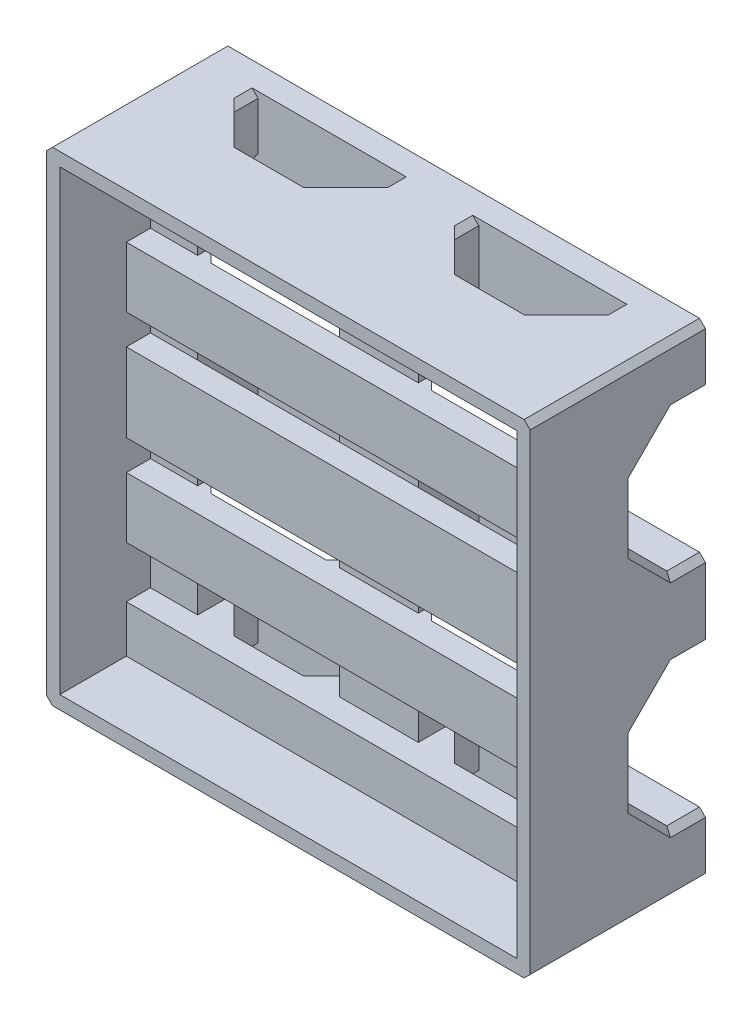
from build123d import *

# Parameters (mm, degrees)
CROQUIS1_W                = 13
CROQUIS1_H                = 80
SALIENTE_EXTRUIR1_DEPTH   = 4
CROQUIS1_W_2              = 10
SALIENTE_EXTRUIR1_2_DEPTH = 4
SALIENTE_EXTRUIR1_3_DEPTH = 4
CROQUIS2_W                = 13
CROQUIS2_H                = 13
CROQUIS2_W_2              = 10
CROQUIS2_H_2              = 10
SALIENTE_EXTRUIR2_DEPTH   = 10
CROQUIS3_W                = 13
CROQUIS3_H                = 80
CROQUIS3_W_2              = 10
SALIENTE_EXTRUIR3_DEPTH   = 2.2
CROQUIS4_W                = 80
CROQUIS4_H                = 10
CROQUIS4_H_2              = 13
SALIENTE_EXTRUIR4_DEPTH   = 4
CROQUIS5_W                = 80
CROQUIS5_H                = 80
CROQUIS5_W_2              = 75.6
CROQUIS5_H_2              = 75.6
SALIENTE_EXTRUIR5_DEPTH   = 15
CHAFL_N2_SIZE             = 6.4
CHAFL_N3_SIZE             = 6
CHAFL_N4_SIZE             = 2.2
CROQUIS6_W                = 10
CROQUIS6_H                = 10
CORTAR_EXTRUIR1_DEPTH     = 0.4
REDONDEO1_R               = 1
CHAFL_N1_SIZE             = 1


with BuildPart() as part:
    # Croquis1 → Saliente-Extruir1 (new body)
    with BuildSketch(Plane(origin=(0, 0, 0), x_dir=(0, 1, 0), z_dir=(0, 0, 1))):
        Rectangle(CROQUIS1_W, CROQUIS1_H)
    extrude(amount=SALIENTE_EXTRUIR1_DEPTH)



with BuildPart() as body_2:
    # Croquis1 → Saliente-Extruir1 2 (new body)
    with BuildSketch(Plane(origin=(0, 0, 0), x_dir=(0, 1, 0), z_dir=(0, 0, 1))):
        with Locations((35, 0)):
            Rectangle(CROQUIS1_W_2, CROQUIS1_H)
    extrude(amount=SALIENTE_EXTRUIR1_2_DEPTH)


with BuildPart() as body_3:
    # Croquis1 → Saliente-Extruir1 3 (new body)
    with BuildSketch(Plane(origin=(0, 0, 0), x_dir=(0, 1, 0), z_dir=(0, 0, 1))):
        with Locations((-35, 0)):
            Rectangle(CROQUIS1_W_2, CROQUIS1_H)
    extrude(amount=SALIENTE_EXTRUIR1_3_DEPTH)


with BuildPart() as part_1:
    add(part.part)

    add(body_2.part)  # Saliente-Extruir2 merges body 2

    add(body_3.part)  # Saliente-Extruir2 merges body 3
    # Croquis2 → Saliente-Extruir2 (add)
    with BuildSketch(Plane.XY.offset(4)):
        Rectangle(CROQUIS2_W, CROQUIS2_H)
        with Locations((-35, 0)):
            Rectangle(CROQUIS2_W_2, CROQUIS2_H)
        with Locations((35, 0)):
            Rectangle(CROQUIS2_W_2, CROQUIS2_H)
        with Locations((0, 35)):
            Rectangle(CROQUIS2_W, CROQUIS2_H_2)
        with Locations((-35, 35)):
            Rectangle(CROQUIS2_W_2, CROQUIS2_H_2)
        with Locations((35, 35)):
            Rectangle(CROQUIS2_W_2, CROQUIS2_H_2)
        with Locations((35, -35)):
            Rectangle(CROQUIS2_W_2, CROQUIS2_H_2)
        with Locations((-35, -35)):
            Rectangle(CROQUIS2_W_2, CROQUIS2_H_2)
        with Locations((0, -35)):
            Rectangle(CROQUIS2_W, CROQUIS2_H_2)
    extrude(amount=SALIENTE_EXTRUIR2_DEPTH)

    # Croquis3 → Saliente-Extruir3 (add)
    with BuildSketch(Plane.XY.offset(14)):
        Rectangle(CROQUIS3_W, CROQUIS3_H)
        with Locations((-35, 0)):
            Rectangle(CROQUIS3_W_2, CROQUIS3_H)
        with Locations((35, 0)):
            Rectangle(CROQUIS3_W_2, CROQUIS3_H)
    extrude(amount=-SALIENTE_EXTRUIR3_DEPTH)

    # Croquis4 → Saliente-Extruir4 (add)
    with BuildSketch(Plane.XY.offset(14)):
        with Locations((0, -35)):
            Rectangle(CROQUIS4_W, CROQUIS4_H)
        Rectangle(CROQUIS4_W, CROQUIS4_H_2)
        with Locations((0, 35)):
            Rectangle(CROQUIS4_W, CROQUIS4_H)
        with Locations((0, 16.5)):
            Rectangle(CROQUIS4_W, CROQUIS4_H)
        with Locations((0, -16.5)):
            Rectangle(CROQUIS4_W, CROQUIS4_H)
    extrude(amount=SALIENTE_EXTRUIR4_DEPTH)

    # Croquis5 → Saliente-Extruir5 (add)
    with BuildSketch(Plane.XY.offset(14)):
        Rectangle(CROQUIS5_W, CROQUIS5_H)
        Rectangle(CROQUIS5_W_2, CROQUIS5_H_2, mode=Mode.SUBTRACT)
    extrude(amount=SALIENTE_EXTRUIR5_DEPTH)

    # Chaflán2
    chafl_n2_edges = [part_1.edges().sort_by_distance(p)[0] for p in [
        (0, -30, 11.8),
        (-35, 6.5, 11.8),
        (-35, -6.5, 11.8),
        (-35, 30, 11.8),
        (-35, -30, 11.8),
        (35, 6.5, 11.8),
        (35, 30, 11.8),
        (35, -6.5, 11.8),
        (35, -30, 11.8),
        (0, 6.5, 11.8),
        (0, -6.5, 11.8),
        (0, 30, 11.8),
    ]]
    chamfer(chafl_n2_edges, length=CHAFL_N2_SIZE)

    # Chaflán3
    chafl_n3_edges = [part_1.edges().sort_by_distance(p)[0] for p in [
        (-6.5, -35, 14),
        (30, -35, 14),
        (6.5, 35, 14),
        (-30, 35, 14),
        (6.5, -35, 14),
        (-6.5, 35, 14),
        (-30, -35, 14),
        (30, 35, 14),
    ]]
    chamfer(chafl_n3_edges, length=CHAFL_N3_SIZE)

    # Chaflán4
    chafl_n4_edges = [part_1.edges().sort_by_distance(p)[0] for p in [
        (30, 16.5, 14),
        (30, -16.5, 14),
        (6.5, -16.5, 14),
        (-6.5, -16.5, 14),
        (-30, -16.5, 14),
        (6.5, 16.5, 14),
        (-30, 16.5, 14),
    ]]
    chamfer(chafl_n4_edges, length=CHAFL_N4_SIZE - 0.0001)  # a hair under: the kernel refuses the full size

    # Croquis6 → Cortar-Extruir1 (cut)
    with BuildSketch(Plane(origin=(-40, 0, 0), x_dir=(0, -1, 0), z_dir=(-1, 0, 0))):
        with Locations((0, 14.5)):
            Rectangle(CROQUIS6_W, CROQUIS6_H)
    extrude(amount=-CORTAR_EXTRUIR1_DEPTH, mode=Mode.SUBTRACT)

    # Redondeo1
    redondeo1_edges = [part_1.edges().sort_by_distance(p)[0] for p in [
        (-39.8, -5, 19.5),
        (-39.8, -5, 9.5),
        (-39.8, 5, 9.5),
        (-39.8, 5, 19.5),
    ]]
    fillet(redondeo1_edges, radius=REDONDEO1_R)

    # Chaflán1
    chafl_n1_edges = [part_1.edges().sort_by_distance(p)[0] for p in [
        (-40, 40, 14.5),
        (-40, -40, 14.5),
        (40, -40, 14.5),
        (40, 6.5, 2.7),
        (-40, 6.5, 2.7),
        (-30, 6.5, 4.7),
        (-6.5, 6.5, 4.7),
        (6.5, 6.5, 4.7),
        (30, 6.5, 4.7),
        (6.5, -6.5, 4.7),
        (-30, -6.5, 4.7),
        (-40, -6.5, 2.7),
        (40, -6.5, 2.7),
        (-40, -18.25, 11.8),
        (30, 30, 4.7),
        (-6.5, 30, 4.7),
        (-30, 30, 4.7),
        (-40, 30, 2.7),
        (40, 30, 2.7),
        (-40, 18.25, 11.8),
        (40, -30, 2.7),
        (-40, -30, 2.7),
        (-30, -30, 4.7),
        (6.5, -30, 4.7),
        (30, -30, 4.7),
        (40, 18.25, 11.8),
        (40, -18.25, 11.8),
        (-40, -9.7, 8.6),
        (-40, 26.8, 8.6),
        (-40, 9.7, 8.6),
        (-40, -26.8, 8.6),
        (40, 9.7, 8.6),
        (40, 26.8, 8.6),
        (40, -9.7, 8.6),
        (40, -26.8, 8.6),
        (30, 40, 6),
        (30, -40, 6),
        (-30, 40, 6),
        (-30, -40, 6),
        (6.5, 40, 6),
        (-6.5, -40, 6),
        (6.5, -40, 6),
        (-6.5, 40, 6),
        (40, 40, 14.5),
    ]]
    chamfer(chafl_n1_edges, length=CHAFL_N1_SIZE)


solid = part_1.part
